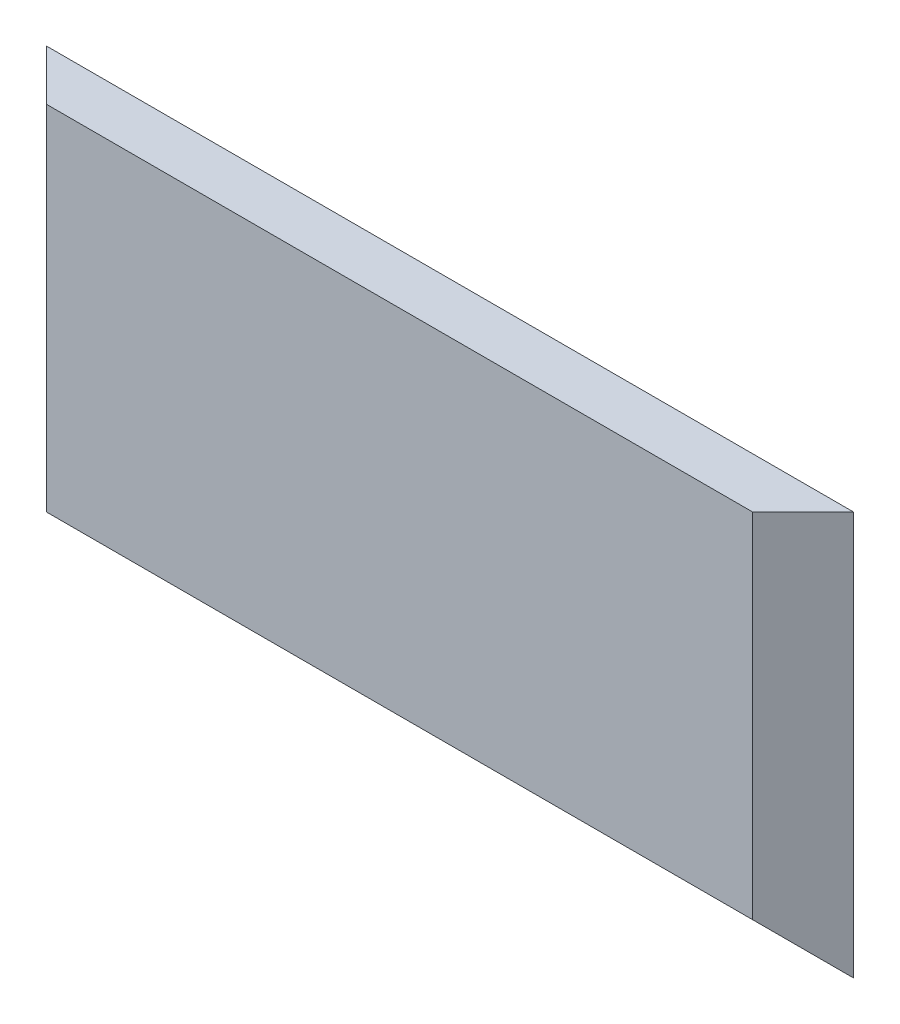
from build123d import *

# Parameters (mm, degrees)
BOSS_EXTRUDE2_DEPTH     = 40
CUT_EXTRUDE1_DEPTH      = 57.623758265
CUT_EXTRUDE1_DEPTH_BACK = 57.623758265


with BuildPart() as part:
    # Sketch3 → Boss-Extrude2 (new body)
    with BuildSketch(Plane(origin=(0, 0, 0), x_dir=(1, 0, 0), z_dir=(0, 1, 0))):
        Polygon((-40, 2.5), (-35, -2.5), (35, -2.5), (40, 2.5), align=None)
    extrude(amount=BOSS_EXTRUDE2_DEPTH)

    # Sketch4 → Cut-Extrude1 (cut, two sides: drawn at the far end of the back side and taken through both)
    with BuildSketch(Plane(origin=(0, 0, 0), x_dir=(0, 0, -1), z_dir=(1, 0, 0)).offset(-CUT_EXTRUDE1_DEPTH_BACK)):
        Polygon((-2.5, 0), (2.5, 0), (-2.5, 5), align=None)
    extrude(amount=CUT_EXTRUDE1_DEPTH + CUT_EXTRUDE1_DEPTH_BACK, mode=Mode.SUBTRACT)


solid = part.part
